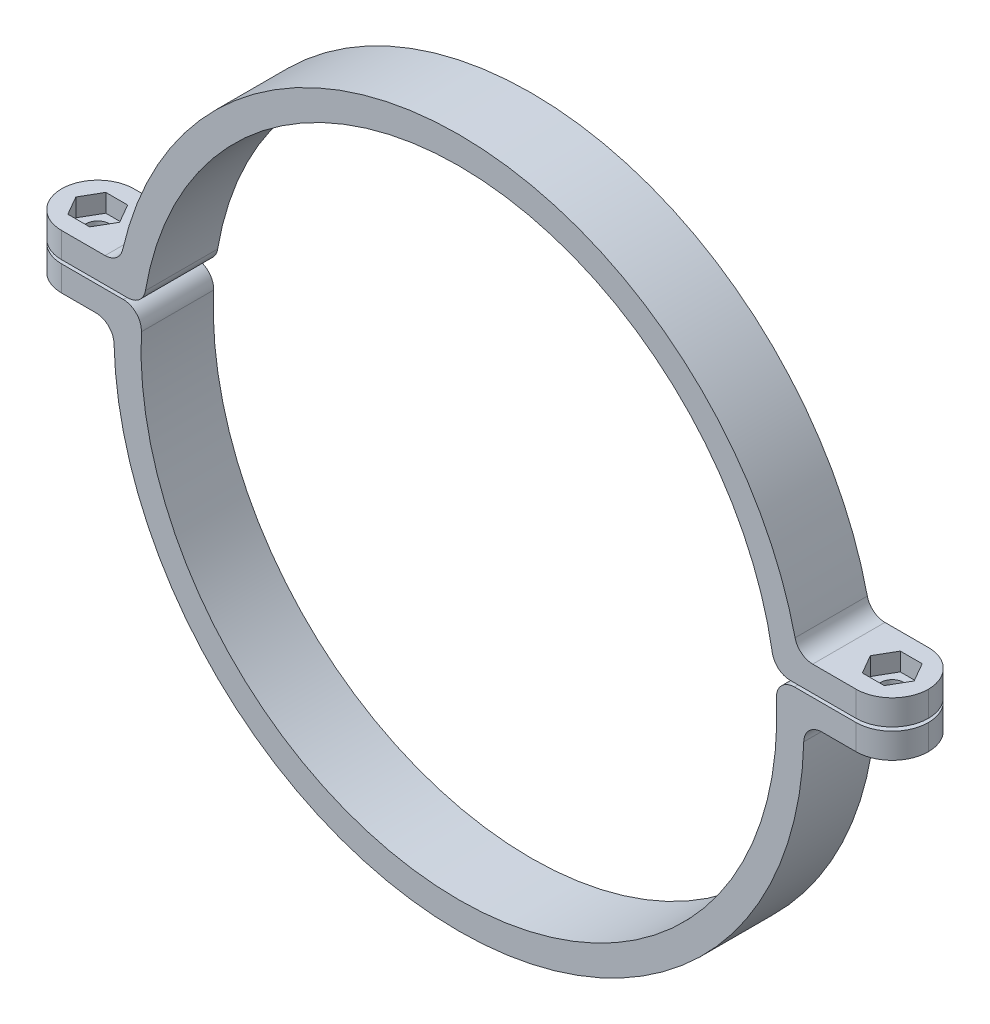
from build123d import *

# Parameters (mm, degrees)
BOSS_EXTRUDE1_DEPTH     = 20
CUT_EXTRUDE1_DEPTH      = 266.13439864
CUT_EXTRUDE1_DEPTH_BACK = 266.13439864
SKETCH3_W               = 20
SKETCH3_H               = 1
FILLET1_R               = 5
FILLET2_R               = 5
FILLET3_R               = 10
FILLET4_R               = 10
CUT_EXTRUDE2_DEPTH      = 5
SKETCH5_R               = 3.25
CUT_EXTRUDE3_DEPTH      = 173.214981616


with BuildPart() as part:
    # Sketch2 → Boss-Extrude1 (new body)
    with BuildSketch(Plane(origin=(0, 0, 40), x_dir=(-1, 0, 0), z_dir=(0, 0, -1))):
        with BuildLine():
            Line((94.97499671, 10), (119.97499671, 10))
            Line((119.97499671, 10), (119.97499671, 17.5))
            Line((119.97499671, 17.5), (93.882905792, 17.5))
            ThreePointArc((93.882905792, 17.5), (94.503382661, 13.760838116), (94.97499671, 10))
        make_face()
        with BuildLine():
            Line((87.429971978, 10), (94.97499671, 10))
            ThreePointArc((94.97499671, 10), (94.503382661, 13.760838116), (93.882905792, 17.5))
            Line((93.882905792, 17.5), (86.242390969, 17.5))
            ThreePointArc((86.242390969, 17.5), (86.917115189, 13.762815379), (87.429971978, 10))
        make_face()
        with BuildLine():
            Line((86.242390969, 17.5), (93.882905792, 17.5))
            ThreePointArc((93.882905792, 17.5), (0, 95.5), (-93.882905792, 17.5))
            Line((-93.882905792, 17.5), (-86.242390969, 17.5))
            ThreePointArc((-86.242390969, 17.5), (0, 88), (86.242390969, 17.5))
        make_face()
        with BuildLine():
            Line((87.964481468, 2.5), (95.467271879, 2.5))
            ThreePointArc((95.467271879, 2.5), (95.294946961, 6.254844819), (94.97499671, 10))
            Line((94.97499671, 10), (87.429971978, 10))
            ThreePointArc((87.429971978, 10), (87.77736653, 6.255711398), (87.964481468, 2.5))
        make_face()
        with BuildLine():
            Line((95.467271879, 2.5), (119.97499671, 2.5))
            Line((119.97499671, 2.5), (119.97499671, 10))
            Line((119.97499671, 10), (94.97499671, 10))
            ThreePointArc((94.97499671, 10), (95.294946961, 6.254844819), (95.467271879, 2.5))
        make_face()
        with BuildLine():
            ThreePointArc((95.5, 0), (95.491817619, 1.250107108), (95.467271879, 2.5))
            Line((95.467271879, 2.5), (87.964481468, 2.5))
            ThreePointArc((87.964481468, 2.5), (87.991119919, 1.25012615), (88, 0))
            ThreePointArc((88, 0), (-1.25012615, -87.991119919), (-87.964481468, 2.5))
            Line((-87.964481468, 2.5), (-95.467271879, 2.5))
            ThreePointArc((-95.467271879, 2.5), (-1.250107108, -95.491817619), (95.5, 0))
        make_face()
        with BuildLine():
            Line((-95.467271879, 2.5), (-87.964481468, 2.5))
            ThreePointArc((-87.964481468, 2.5), (-87.77736653, 6.255711398), (-87.429971978, 10))
            Line((-87.429971978, 10), (-94.97499671, 10))
            ThreePointArc((-94.97499671, 10), (-95.294946961, 6.254844819), (-95.467271879, 2.5))
        make_face()
        with BuildLine():
            Line((-94.97499671, 10), (-87.429971978, 10))
            ThreePointArc((-87.429971978, 10), (-86.917115189, 13.762815379), (-86.242390969, 17.5))
            Line((-86.242390969, 17.5), (-93.882905792, 17.5))
            ThreePointArc((-93.882905792, 17.5), (-94.503382661, 13.760838116), (-94.97499671, 10))
        make_face()
        with BuildLine():
            Line((-119.97499671, 10), (-94.97499671, 10))
            ThreePointArc((-94.97499671, 10), (-94.503382661, 13.760838116), (-93.882905792, 17.5))
            Line((-93.882905792, 17.5), (-119.97499671, 17.5))
            Line((-119.97499671, 17.5), (-119.97499671, 10))
        make_face()
        with BuildLine():
            Line((-119.97499671, 2.5), (-95.467271879, 2.5))
            ThreePointArc((-95.467271879, 2.5), (-95.294946961, 6.254844819), (-94.97499671, 10))
            Line((-94.97499671, 10), (-119.97499671, 10))
            Line((-119.97499671, 10), (-119.97499671, 2.5))
        make_face()
    extrude(amount=-BOSS_EXTRUDE1_DEPTH)

    # Sketch3 → Cut-Extrude1 (cut, two sides: drawn at the far end of the back side and taken through both)
    with BuildSketch(Plane(origin=(119.97499671, 0, 0), x_dir=(0, 0, -1), z_dir=(1, 0, 0)).offset(-CUT_EXTRUDE1_DEPTH_BACK)):
        with Locations((-50, 10)):
            Rectangle(SKETCH3_W, SKETCH3_H)
    extrude(amount=CUT_EXTRUDE1_DEPTH + CUT_EXTRUDE1_DEPTH_BACK, mode=Mode.SUBTRACT)


with BuildPart() as cut_extrude1_piece_1:
    # of the separate pieces the step leaves, piece 1, a body of its own (cut_extrude1_pieces)
    add(part.part.solids().sort_by_distance((-119.97499671, 2.5, 40))[0])

    # Fillet2
    fillet2_edges = [cut_extrude1_piece_1.edges().sort_by_distance(p)[0] for p in [
        (-95.467271879, 2.5, 50),
        (95.467271879, 2.5, 50),
        (87.485713119, 9.5, 50),
        (-87.485713119, 9.5, 50),
    ]]
    fillet(fillet2_edges, radius=FILLET2_R)

    # Fillet3
    fillet3_edges = [cut_extrude1_piece_1.edges().sort_by_distance(p)[0] for p in [
        (119.97499671, 6, 60),
        (-119.97499671, 6, 40),
        (-119.97499671, 6, 60),
        (119.97499671, 6, 40),
    ]]
    fillet(fillet3_edges, radius=FILLET3_R - 0.0001)  # a hair under: the kernel refuses the full size


with BuildPart() as cut_extrude1_piece_2:
    # of the separate pieces the step leaves, piece 2, a body of its own (cut_extrude1_pieces)
    add(part.part.solids().sort_by_distance((-119.97499671, 10.5, 40))[0])

    # Fillet1
    fillet1_edges = [cut_extrude1_piece_2.edges().sort_by_distance(p)[0] for p in [
        (93.882905792, 17.5, 50),
        (-93.882905792, 17.5, 50),
        (87.371333972, 10.5, 50),
        (-87.371333972, 10.5, 50),
    ]]
    fillet(fillet1_edges, radius=FILLET1_R)

    # Fillet4
    fillet4_edges = [cut_extrude1_piece_2.edges().sort_by_distance(p)[0] for p in [
        (-119.97499671, 14, 60),
        (-119.97499671, 14, 40),
        (119.97499671, 14, 60),
        (119.97499671, 14, 40),
    ]]
    fillet(fillet4_edges, radius=FILLET4_R - 0.0001)  # a hair under: the kernel refuses the full size

    # Sketch4 → Cut-Extrude2 (cut)
    with BuildSketch(Plane(origin=(0, 17.5, 0), x_dir=(1, 0, 0), z_dir=(0, 1, 0))):
        Polygon((106.943907796, -55.25), (113.006085623, -55.25), (116.037174536, -50), (113.006085623, -44.75), (106.943907796, -44.75), (103.912818883, -50), align=None)
        Polygon((-103.912818883, -50), (-106.943907796, -44.75), (-113.006085623, -44.75), (-116.037174536, -50), (-113.006085623, -55.25), (-106.943907796, -55.25), align=None)
    extrude(amount=-CUT_EXTRUDE2_DEPTH, mode=Mode.SUBTRACT)


with BuildPart() as cut_extrude3_tool:
    # Sketch5 → Cut-Extrude3 (new, through all)
    with BuildSketch(Plane(origin=(0, 12.5, 0), x_dir=(1, 0, 0), z_dir=(0, 1, 0))):
        with Locations(Location((-109.97499671, -50, 0), (0, 0, 270))):
            Circle(SKETCH5_R)
        with Locations(Location((109.97499671, -50, 0), (0, 0, 270))):
            Circle(SKETCH5_R)
    extrude(amount=-CUT_EXTRUDE3_DEPTH)


with BuildPart() as cut_extrude1_piece_1_1:
    add(cut_extrude1_piece_1.part)

    # Cut-Extrude3: cut by cut_extrude3_tool
    add(cut_extrude3_tool.part, mode=Mode.SUBTRACT)


with BuildPart() as cut_extrude1_piece_2_1:
    add(cut_extrude1_piece_2.part)

    # Cut-Extrude3: cut by cut_extrude3_tool
    add(cut_extrude3_tool.part, mode=Mode.SUBTRACT)


solid = Compound([cut_extrude1_piece_1_1.part, cut_extrude1_piece_2_1.part])
